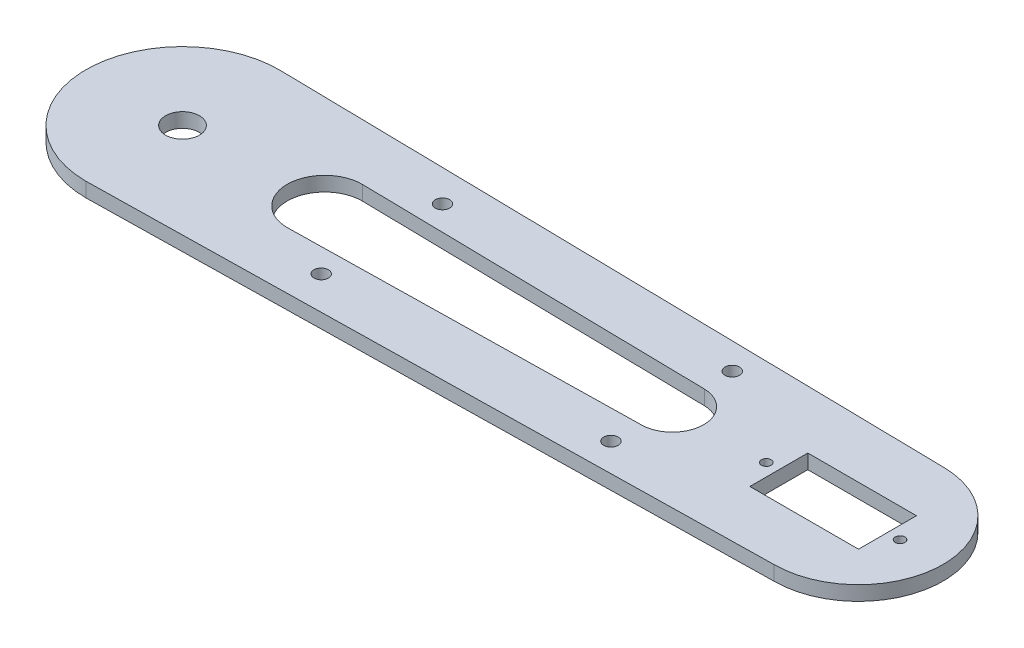
from build123d import *

# Parameters (mm, degrees)
BOSS_EXTRUDE1_DEPTH = 3
SKETCH2_R           = 3.5
SKETCH2_R_2         = 1
SKETCH2_W           = 22.5
SKETCH2_H           = 12
CUT_EXTRUDE1_DEPTH  = 159.793104384
CUT_EXTRUDE3_DEPTH  = 159.793104384
SKETCH9_R           = 4.496455738
CUT_EXTRUDE7_DEPTH  = 10
SKETCH10_R          = 1.5
CUT_EXTRUDE8_DEPTH  = 10


with BuildPart() as part:
    # Sketch1 → Boss-Extrude1 (new body)
    with BuildSketch(Plane(origin=(0, 0, 0), x_dir=(1, 0, 0), z_dir=(0, 1, 0))):
        with BuildLine():
            Line((140.3125, 17.497209599), (0.357142857, 19.99681097))
            ThreePointArc((0.357142857, 19.99681097), (-19.999202727, 0.178578547), (0, -20))
            Line((0, -20), (140, -17.5))
            ThreePointArc((140, -17.5), (157.499302386, -0.156256229), (140.3125, 17.497209599))
        make_face()
    extrude(amount=BOSS_EXTRUDE1_DEPTH)

    # Sketch2 → Cut-Extrude1 (cut, through all)
    # profile 1 of 4: a face of its own
    with BuildSketch(Plane(origin=(0, 3, 0), x_dir=(1, 0, 0), z_dir=(0, 1, 0))):
        Circle(SKETCH2_R)
    # profile 2 of 4: a face of its own
    with BuildSketch(Plane(origin=(0, 3, 0), x_dir=(1, 0, 0), z_dir=(0, 1, 0))):
        with Locations((148.6, 0)):
            Circle(SKETCH2_R_2)
    # profile 3 of 4: a face of its own
    with BuildSketch(Plane(origin=(0, 3, 0), x_dir=(1, 0, 0), z_dir=(0, 1, 0))):
        with Locations((120.9, 0)):
            Circle(SKETCH2_R_2)
    # profile 4 of 4: a face of its own
    with BuildSketch(Plane(origin=(0, 3, 0), x_dir=(1, 0, 0), z_dir=(0, 1, 0))):
        with Locations((134.75, 0)):
            Rectangle(SKETCH2_W, SKETCH2_H)
        with Locations((140, 0)):
            Circle(SKETCH2_R, mode=Mode.SUBTRACT)
    extrude(amount=-CUT_EXTRUDE1_DEPTH, mode=Mode.SUBTRACT)


with BuildPart() as cut_extrude1_piece_1:
    # of the separate pieces the step leaves, piece 1, a body of its own (cut_extrude1_pieces)
    add(part.part.solids().sort_by_distance((140, 0, 17.5))[0])

    # Sketch4 → Cut-Extrude3 (cut, through all)
    with BuildSketch(Plane(origin=(0, 3, 0), x_dir=(1, 0, 0), z_dir=(0, 1, 0))):
        with BuildLine():
            ThreePointArc((101.494647455, -6.185682468), (107.64017994, 0.394224207), (101.283865867, 6.770744637))
            Line((101.283865867, 6.770744637), (29.173044697, 8.058643229))
            ThreePointArc((29.173044697, 8.058643229), (21.397292905, 0.29833633), (29.157599804, -7.477415462))
            Line((29.157599804, -7.477415462), (101.052392136, -6.193579885))
            Line((101.052392136, -6.193579885), (101.494647455, -6.185682468))
        make_face()
    extrude(amount=-CUT_EXTRUDE3_DEPTH, mode=Mode.SUBTRACT)

    # Sketch10 → Cut-Extrude8 (cut)
    with BuildSketch(Plane(origin=(0, 3, 0), x_dir=(1, 0, 0), z_dir=(0, 1, 0))):
        with Locations((40.994069635, 12.848317219)):
            Circle(SKETCH10_R)
        with Locations((40.994069635, -12.26684706)):
            Circle(SKETCH10_R)
        with Locations((100.994069635, -12.26684706)):
            Circle(SKETCH10_R)
        with Locations((100.994069635, 12.848317219)):
            Circle(SKETCH10_R)
    extrude(amount=-CUT_EXTRUDE8_DEPTH, mode=Mode.SUBTRACT)


with BuildPart() as cut_extrude1_piece_2:
    # of the separate pieces the step leaves, piece 2, a body of its own (cut_extrude1_pieces)
    add(part.part.solids().sort_by_distance((143.5, 0, 0))[0])

    # Sketch9 → Cut-Extrude7 (cut)
    with BuildSketch(Plane(origin=(0, 3, 0), x_dir=(1, 0, 0), z_dir=(0, 1, 0))):
        with Locations((140, 0)):
            Circle(SKETCH9_R)
    extrude(amount=-CUT_EXTRUDE7_DEPTH, mode=Mode.SUBTRACT)


solid = cut_extrude1_piece_1.part
